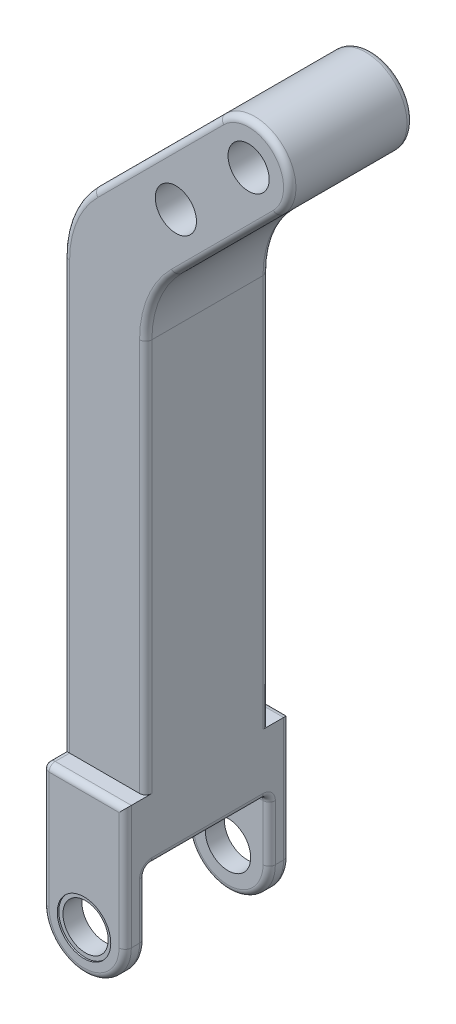
from build123d import *

# Parameters (mm, degrees)
SKETCH_1_R          = 20
SKETCH_1_R_2        = 10
EXTRUDE_1_DEPTH     = 60
EXTRUDE_2_DEPTH     = 30
SKETCH_4_R          = 11
EXTRUDE_3_DEPTH     = 10
SKETCH_8_R          = 10
CUT_EXTRUDE_1_DEPTH = 100
FILLET_1_R          = 50
FILLET_2_R          = 3
SKETCH_9_R          = 13
CUT_EXTRUDE_2_DEPTH = 0.75
CUT_EXTRUDE_START   = -0.75
SKETCH_10_R         = 13
CUT_EXTRUDE_3_DEPTH = 0.75


with BuildPart() as part:
    # 草图1 → 凸台-拉伸1 (new body)
    with BuildSketch(Plane.XY):
        Circle(SKETCH_1_R)
        Circle(SKETCH_1_R_2, mode=Mode.SUBTRACT)
    extrude(amount=EXTRUDE_1_DEPTH)

    # 草图2 → 凸台-拉伸2 (add, symmetric)
    with BuildSketch(Plane.XY.offset(30)):
        with BuildLine():
            Line((-14.142135624, 14.142135624), (-90, -61.715728753))
            Line((-90, -61.715728753), (-90, -320))
            Line((-90, -320), (-50, -320))
            Line((-50, -320), (-50, -78.284271247))
            Line((-50, -78.284271247), (14.142135624, -14.142135624))
            ThreePointArc((14.142135624, -14.142135624), (-14.142135624, -14.142135624), (-14.142135624, 14.142135624))
        make_face()
    extrude(amount=EXTRUDE_2_DEPTH, both=True)

    # 草图4 → 凸台-拉伸3 (add)
    with BuildSketch(Plane.XY.offset(60)):
        with BuildLine():
            Line((-90, -290), (-50, -290))
            Line((-50, -290), (-50, -350))
            ThreePointArc((-50, -350), (-70, -370), (-90, -350))
            Line((-90, -350), (-90, -290))
        make_face()
        with Locations((-70, -350)):
            Circle(SKETCH_4_R, mode=Mode.SUBTRACT)
    extrude_3 = extrude(amount=EXTRUDE_3_DEPTH)

    # 镜向1: 凸台-拉伸3 across plane
    add(extrude_3.mirror(Plane.XY.offset(30)))

    # 草图8 → 切除-拉伸1 (cut)
    with BuildSketch(Plane.XY.offset(60)):
        with Locations((-35.355339059, -35.355339059)):
            Circle(SKETCH_8_R)
    extrude(amount=-CUT_EXTRUDE_1_DEPTH, mode=Mode.SUBTRACT)

    # 圆角1
    fillet_1_edges = [part.edges().sort_by_distance(p)[0] for p in [
        (-90, -61.715728753, 30),
        (-50, -78.284271247, 30),
    ]]
    fillet(fillet_1_edges, radius=FILLET_1_R)

    # 圆角2
    fillet_2_edges = [part.edges().sort_by_distance(p)[0] for p in [
        (-50, -320, 70),
        (-70, -370, 70),
        (-50, -335, 60),
        (-70, -370, 60),
        (-50, -335, 0),
        (-70, -370, 0),
        (-50, -320, -10),
        (-70, -370, -10),
        (-70, -320, 60),
        (-50, -320, 30),
        (-70, -320, 0),
        (-90, -290, 65),
        (-90, -320, 70),
        (-90, -335, 60),
        (-90, -320, 30),
        (-90, -335, 0),
        (-90, -320, -10),
        (-90, -290, -5),
        (-50, -194.497474683, 0),
        (-46.193976626, -79.860777748, 0),
        (-10.606601718, -38.890872965, 0),
        (14.142135624, 14.142135624, 0),
        (-44.748737342, -16.464466094, 0),
        (-86.193976626, -63.292235253, 0),
        (-90, -186.213203436, 0),
        (14.142135624, 14.142135624, 60),
        (-10.606601718, -38.890872965, 60),
        (-46.193976626, -79.860777748, 60),
        (-50, -194.497474683, 60),
        (-90, -186.213203436, 60),
        (-86.193976626, -63.292235253, 60),
        (-44.748737342, -16.464466094, 60),
        (-70, -290, 70),
        (-70, -290, -10),
    ]]
    fillet(fillet_2_edges, radius=FILLET_2_R)

    # 草图9 → 切除-拉伸2 (cut)
    with BuildSketch(Plane.XY.offset(70)):
        with Locations((-70, -350)):
            Circle(SKETCH_9_R)
    extrude(amount=-CUT_EXTRUDE_2_DEPTH, mode=Mode.SUBTRACT)

    # 草图10 → 切除-拉伸3 (cut)
    with BuildSketch(Plane(origin=(0, 0, -10), x_dir=(-1, 0, 0), z_dir=(0, 0, -1)).offset(CUT_EXTRUDE_START)):
        with Locations((70, -350)):
            Circle(SKETCH_10_R)
    extrude(amount=CUT_EXTRUDE_3_DEPTH, mode=Mode.SUBTRACT)


solid = part.part
